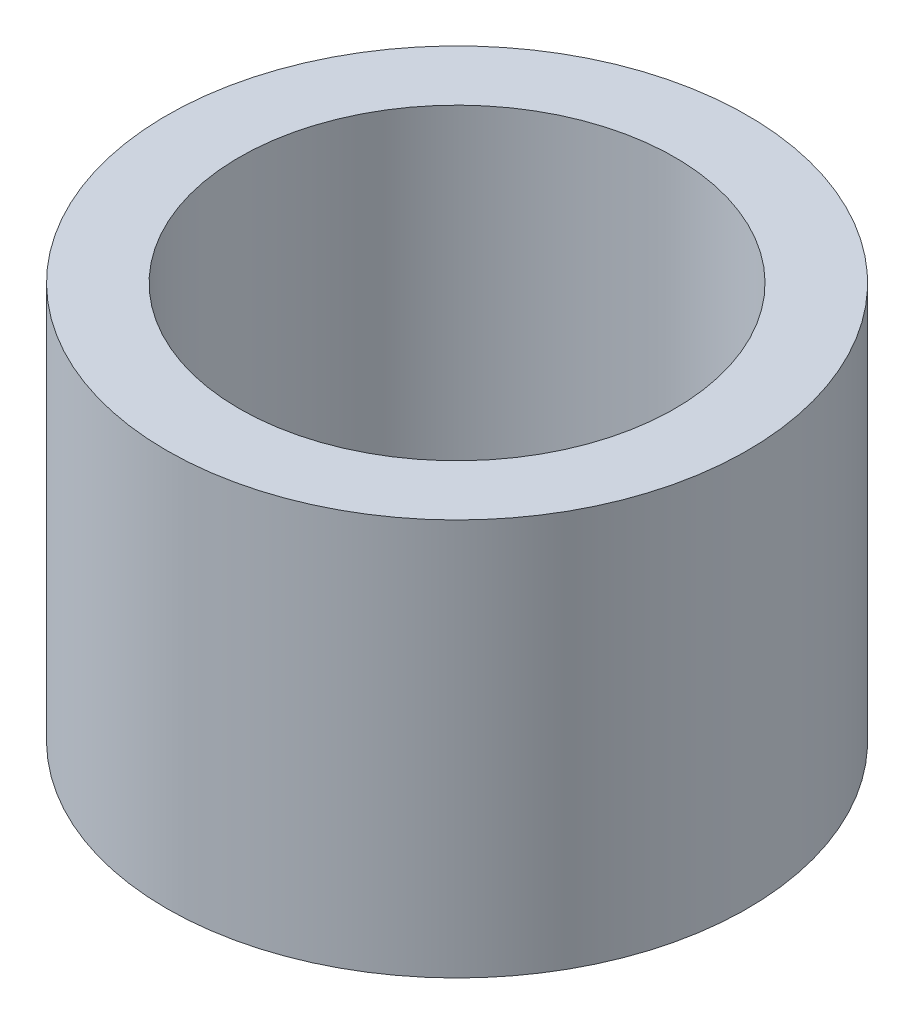
from build123d import *

# Parameters (mm, degrees)
SKETCH1_R           = 25
BOSS_EXTRUDE1_DEPTH = 34.158669925
SKETCH2_R           = 18.754909476
CUT_EXTRUDE1_DEPTH  = 50.161109945


with BuildPart() as part:
    # Sketch1 → Boss-Extrude1 (new body)
    with BuildSketch(Plane(origin=(0, 0, 0), x_dir=(1, 0, 0), z_dir=(0, 1, 0))):
        Circle(SKETCH1_R)
    extrude(amount=BOSS_EXTRUDE1_DEPTH)

    # Sketch2 → Cut-Extrude1 (cut, through all)
    with BuildSketch(Plane(origin=(0, 0, 0), x_dir=(1, 0, 0), z_dir=(0, 1, 0))):
        Circle(SKETCH2_R)
    extrude(amount=CUT_EXTRUDE1_DEPTH, mode=Mode.SUBTRACT)


solid = part.part
